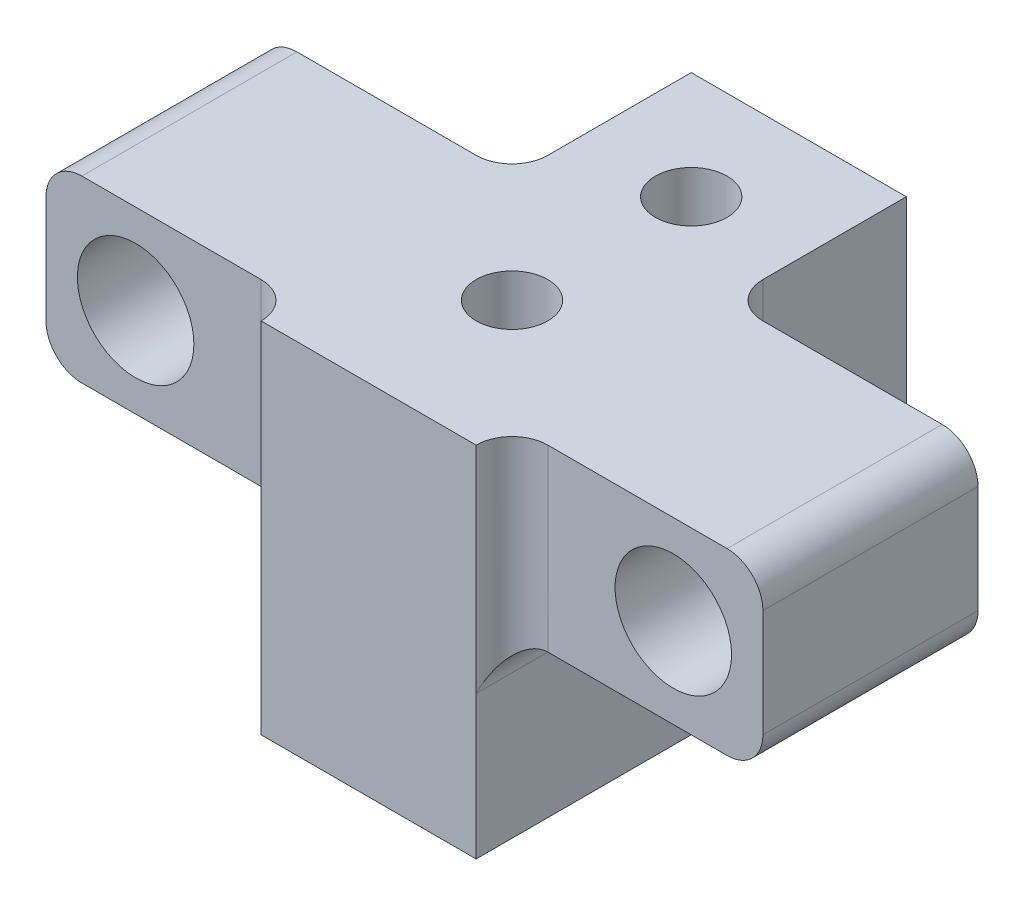
from build123d import *

# Parameters (mm, degrees)
SKETCH2_W               = 6
SKETCH2_H               = 12
SKETCH2_W_2             = 20
SKETCH2_H_2             = 6
BOSS_EXTRUDE1_DEPTH     = 10
SKETCH6_R               = 1
CUT_EXTRUDE2_DEPTH      = 16.362291496
CUT_EXTRUDE4_DEPTH      = 16.362291496
CUT_EXTRUDE4_DEPTH_BACK = 16.362291496
SKETCH7_R               = 1.625
FILLET1_R               = 1


with BuildPart() as part:
    # Sketch2 → Boss-Extrude1 (new body)
    with BuildSketch(Plane(origin=(0, 0, 0), x_dir=(1, 0, 0), z_dir=(0, 1, 0))):
        Rectangle(SKETCH2_W, SKETCH2_H)
        with Locations((0, -2)):
            Rectangle(SKETCH2_W_2, SKETCH2_H_2)
    extrude(amount=BOSS_EXTRUDE1_DEPTH)

    # Sketch6 → Cut-Extrude2 (cut, through all)
    with BuildSketch(Plane(origin=(0, 0, 0), x_dir=(1, 0, 0), z_dir=(0, 1, 0))):
        with Locations(Location((0, 3, 0), (0, 0, 270))):
            Circle(SKETCH6_R)
        with Locations(Location((0, -2, 0), (0, 0, 270))):
            Circle(SKETCH6_R)
    extrude(amount=CUT_EXTRUDE2_DEPTH, mode=Mode.SUBTRACT)

    # Sketch7 → Cut-Extrude4 (cut, two sides: drawn at the far end of the back side and taken through both)
    with BuildSketch(Plane.XY.offset(-CUT_EXTRUDE4_DEPTH_BACK)):
        with Locations((-7.5, 7.5)):
            Circle(SKETCH7_R)
        with Locations((7.5, 7.5)):
            Circle(SKETCH7_R)
        with BuildLine():
            Line((-10, 0), (-3, 0))
            Line((-3, 0), (-3, 4))
            ThreePointArc((-3, 4), (-3.292893219, 4.707106781), (-4, 5))
            Line((-4, 5), (-10, 5))
            Line((-10, 5), (-10, 0))
        make_face()
        with BuildLine():
            Line((3, 0), (3, 4))
            ThreePointArc((3, 4), (3.292893219, 4.707106781), (4, 5))
            Line((4, 5), (10, 5))
            Line((10, 5), (10, 0))
            Line((10, 0), (3, 0))
        make_face()
    extrude(amount=CUT_EXTRUDE4_DEPTH + CUT_EXTRUDE4_DEPTH_BACK, mode=Mode.SUBTRACT)

    # Fillet1
    fillet1_edges = [part.edges().sort_by_distance(p)[0] for p in [
        (10, 5, 2),
        (10, 10, 2),
        (-10, 5, 2),
        (-10, 10, 2),
        (-3, 7, 5),
        (3, 7, 5),
        (3, 7, -1),
        (-3, 7, -1),
    ]]
    fillet(fillet1_edges, radius=FILLET1_R - 0.0001)  # a hair under: the kernel refuses the full size


solid = part.part
